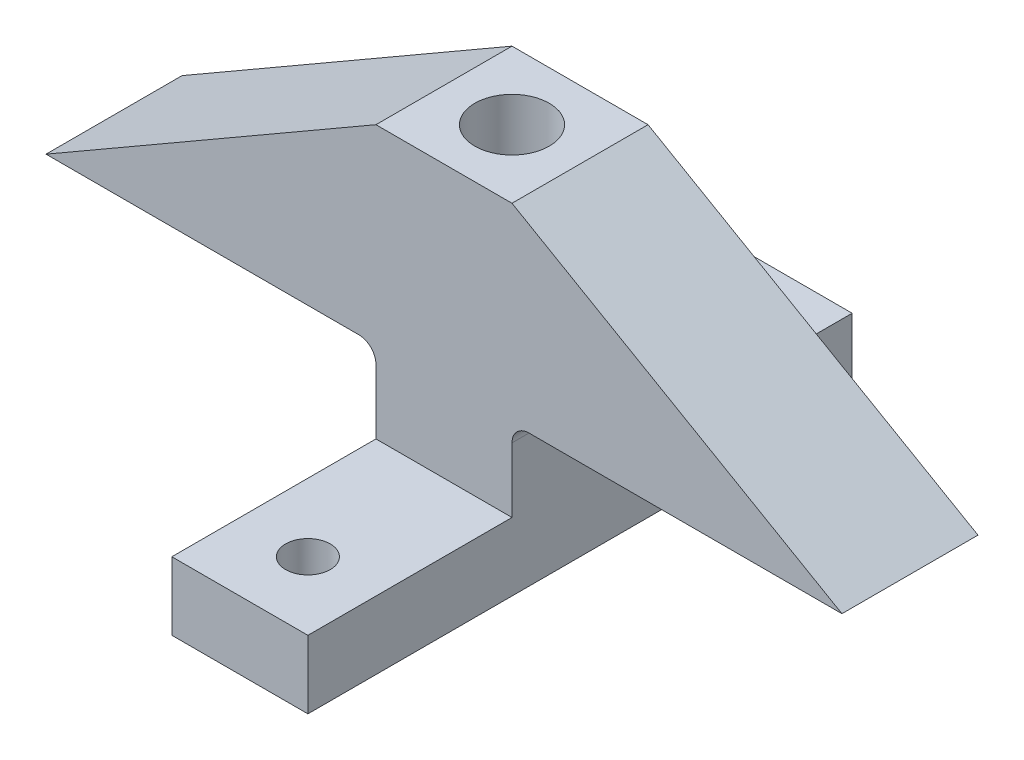
from build123d import *

# Parameters (mm, degrees)
BOSS_EXTRUDE1_DEPTH        = 25.4
SKETCH2_W                  = 25.4
SKETCH2_H                  = 12.7
BOSS_EXTRUDE2_DEPTH        = 38.1
SKETCH3_W                  = 25.4
SKETCH3_H                  = 13.97
BOSS_EXTRUDE3_DEPTH        = 38.1
F_0_328IN_DOWEL_HOLE1_D    = 8.3312
F_0_55IN_DOWEL_HOLE2_D     = 13.8938
F_0_55IN_DOWEL_HOLE2_DEPTH = 35.052
F_0_55IN_DOWEL_HOLE2_TIP   = 4.174118634
FILLET1_R                  = 3.175


with BuildPart() as part:
    # Sketch1 → Boss-Extrude1 (new body)
    with BuildSketch(Plane.XY):
        Polygon((0, 0), (0, 27.94), (-61.591726717, 27.94), (0, 63.5), (25.4, 63.5), (86.991726717, 27.94), (25.4, 27.94), (25.4, 0), align=None)
    extrude(amount=BOSS_EXTRUDE1_DEPTH)

    # Sketch2 → Boss-Extrude2 (add)
    with BuildSketch(Plane.XY.offset(25.4)):
        with Locations((12.7, 6.35)):
            Rectangle(SKETCH2_W, SKETCH2_H)
    extrude(amount=BOSS_EXTRUDE2_DEPTH)

    # Sketch3 → Boss-Extrude3 (add)
    with BuildSketch(Plane(origin=(0, 0, 0), x_dir=(-1, 0, 0), z_dir=(0, 0, -1))):
        with Locations((-12.7, 6.985)):
            Rectangle(SKETCH3_W, SKETCH3_H)
    extrude(amount=BOSS_EXTRUDE3_DEPTH)

    # Ø0.328in Dowel Hole1 (through all)
    with Locations(Plane(origin=(0, 13.97, 0), x_dir=(1, 0, 0), z_dir=(0, 1, 0))):
        with Locations((12.7, 25.4), (12.7, -50.8)):
            Hole(F_0_328IN_DOWEL_HOLE1_D / 2)

    # Ø0.55in Dowel Hole2
    with Locations(Plane(origin=(0, 63.5, 0), x_dir=(1, 0, 0), z_dir=(0, 1, 0))):
        with Locations((12.7, -12.7)):
            Hole(F_0_55IN_DOWEL_HOLE2_D / 2, depth=F_0_55IN_DOWEL_HOLE2_DEPTH)
            with Locations((0, 0, -(F_0_55IN_DOWEL_HOLE2_DEPTH + F_0_55IN_DOWEL_HOLE2_TIP / 2))):  # 118° drill point
                Cone(0, F_0_55IN_DOWEL_HOLE2_D / 2, F_0_55IN_DOWEL_HOLE2_TIP, mode=Mode.SUBTRACT)

    # Fillet1
    fillet1_edges = [part.edges().sort_by_distance(p)[0] for p in [
        (25.4, 27.94, 12.7),
        (0, 27.94, 12.7),
    ]]
    fillet(fillet1_edges, radius=FILLET1_R)


solid = part.part
